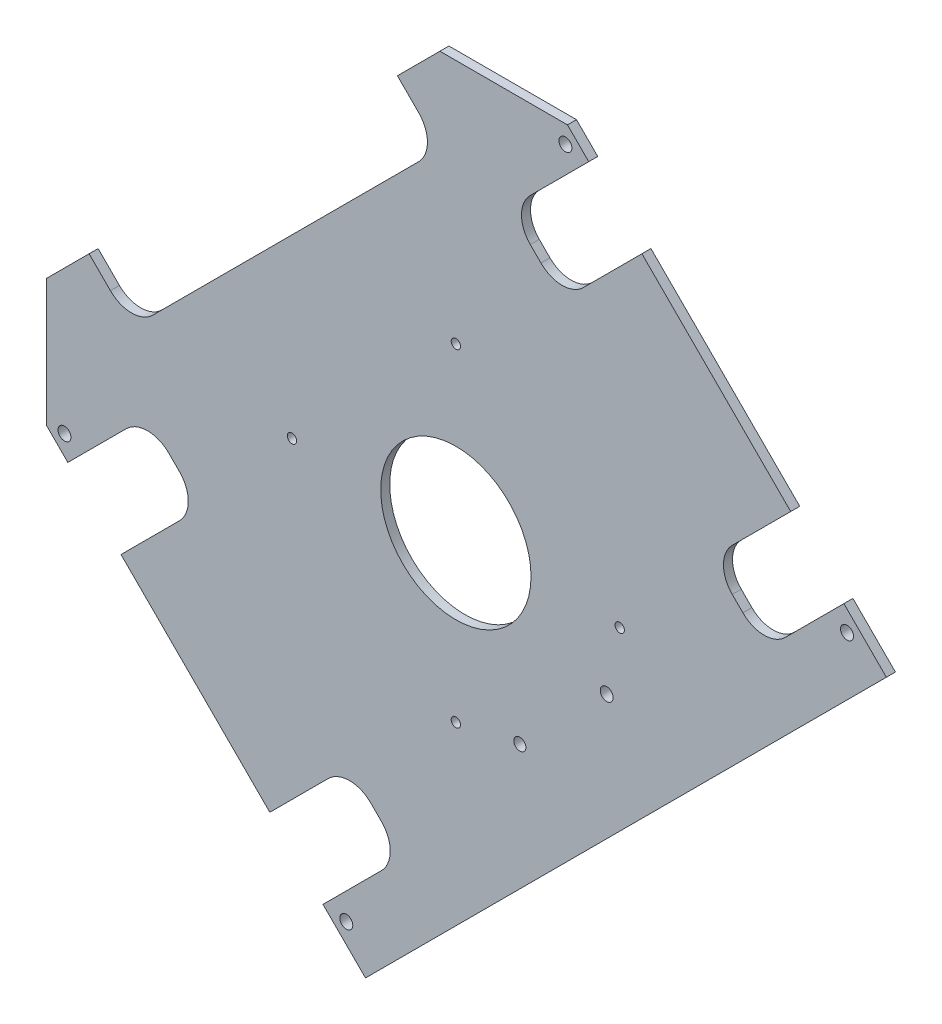
from build123d import *

# Parameters (mm, degrees)
SKETCH1_R          = 25
SKETCH1_R_2        = 2.15
SKETCH1_R_3        = 1.55
SKETCH1_R_4        = 2
EXTRUDE1_DEPTH     = 3
FILLET1_R          = 10
FILLET2_R          = 10
CHAMFER1_SIZE      = 30
SKETCH3_R          = 2.15
CUT_EXTRUDE1_DEPTH = 3


with BuildPart() as part:
    # Sketch1 → Extrude1 (new body)
    with BuildSketch(Plane.XY):
        Polygon((17.677615256, 102.530428998), (44.19411955, 129.046933293), (15.909848303, 157.33120454), (-19.445490757, 121.975865481), (-5.303355133, 107.833729857), (-107.833729857, 5.303355133), (-121.975865481, 19.445490757), (-157.33120454, -15.909848303), (-129.046933293, -44.19411955), (-102.530428998, -17.677615256), (-84.852759469, -35.355284785), (-111.369263763, -61.87178908), (-61.87178908, -111.369263763), (-35.355284785, -84.852759469), (-17.677615256, -102.530428998), (-44.19411955, -129.046933293), (-30.051983927, -143.189068916), (143.189068916, 30.051983927), (129.046933293, 44.19411955), (102.530428998, 17.677615256), (84.852759468, 35.355284785), (111.369263763, 61.87178908), (61.87178908, 111.369263763), (35.355284785, 84.852759468), align=None)
        Circle(SKETCH1_R, mode=Mode.SUBTRACT)
        with Locations((50.167514513, -21.294846503)):
            Circle(SKETCH1_R_2, mode=Mode.SUBTRACT)
        with Locations((54.5, 0)):
            Circle(SKETCH1_R_3, mode=Mode.SUBTRACT)
        with Locations((0, 54.5)):
            Circle(SKETCH1_R_3, mode=Mode.SUBTRACT)
        with Locations((0, -54.5)):
            Circle(SKETCH1_R_3, mode=Mode.SUBTRACT)
        with Locations((21.294846503, -50.167514513)):
            Circle(SKETCH1_R_4, mode=Mode.SUBTRACT)
        with Locations((-54.5, 0)):
            Circle(SKETCH1_R_3, mode=Mode.SUBTRACT)
    extrude(amount=EXTRUDE1_DEPTH)

    # Fillet1
    fillet1_edges = [part.edges().sort_by_distance(p)[0] for p in [
        (-5.303355133, 107.833729857, 1.5),
        (-107.833729857, 5.303355133, 1.5),
    ]]
    fillet(fillet1_edges, radius=FILLET1_R)

    # Fillet2
    fillet2_edges = [part.edges().sort_by_distance(p)[0] for p in [
        (35.355284785, 84.852759468, 1.5),
        (17.677615256, 102.530428998, 1.5),
        (84.852759468, 35.355284785, 1.5),
        (102.530428998, 17.677615256, 1.5),
        (-17.677615256, -102.530428998, 1.5),
        (-35.355284785, -84.852759469, 1.5),
        (-84.852759469, -35.355284785, 1.5),
        (-102.530428998, -17.677615256, 1.5),
    ]]
    fillet(fillet2_edges, radius=FILLET2_R)

    # Chamfer1
    chamfer1_edges = [part.edges().sort_by_distance(p)[0] for p in [
        (-157.33120454, -15.909848303, 1.5),
        (15.909848303, 157.33120454, 1.5),
    ]]
    chamfer(chamfer1_edges, length=CHAMFER1_SIZE)

    # Sketch3 → Cut-Extrude1 (cut)
    with BuildSketch(Plane.XY.offset(3)):
        with Locations((130.088671099, 36.36369146)):
            Circle(SKETCH3_R)
        with Locations((36.434402139, 130.159381777)):
            Circle(SKETCH3_R)
        with Locations((-36.434402139, -130.159381777)):
            Circle(SKETCH3_R)
        with Locations((-130.159381777, -36.434402139)):
            Circle(SKETCH3_R)
    extrude(amount=-CUT_EXTRUDE1_DEPTH, mode=Mode.SUBTRACT)


solid = part.part
